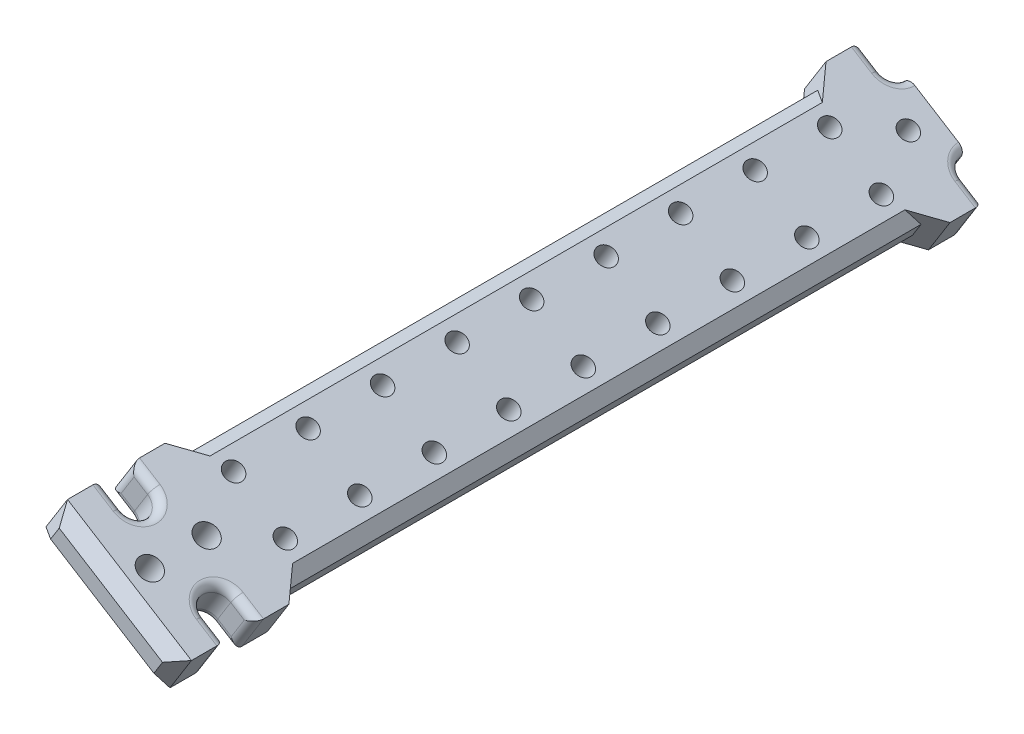
from build123d import *

# Parameters (mm, degrees)
BOSS_EXTRU_1_OUTLINE_R   = 2.75
BOSS_EXTRU_1_OUTLINE_R_2 = 2.3
BOSS_EXTRU_1_DEPTH       = 10
ESQUISSE2_R              = 2.3
ENL_V_MAT_EXTRU_1_DEPTH  = 192.889965503
CONG_1_R                 = 2
CHANFREIN1_SIZE          = 3


# Read off the part's stored shape, not the designer's step: Boss.-Extru.1
with BuildPart() as part:
    # Boss.-Extru.1 outline → Boss.-Extru.1 (new body)
    with BuildSketch(Plane(origin=(0.807648755, 1.292238009, 0), x_dir=(0.8479983040028684, -0.5299989400067315, 0), z_dir=(0.5299989400067315, 0.8479983040028684, 0))):
        with BuildLine():
            Line((-3.319738136, 183.05), (-9.244866887, 183.05))
            ThreePointArc((-9.244866887, 183.05), (-11.896517316, 184.148349571), (-12.994866887, 186.8))
            Line((-12.994866887, 186.8), (-29.644053825, 186.8))
            ThreePointArc((-29.644053825, 186.8), (-30.742403396, 184.148349571), (-33.394053825, 183.05))
            Line((-33.394053825, 183.05), (-39.319182576, 183.05))
            Line((-39.319182576, 183.05), (-39.319182576, 174.8))
            Line((-39.319182576, 174.8), (-36.319182576, 171.8))
            Line((-36.319182576, 171.8), (-36.319182576, 15))
            Line((-36.319182576, 15), (-39.319182576, 12))
            Line((-39.319182576, 12), (-39.319182576, 3.75))
            Line((-39.319182576, 3.75), (-33.394053825, 3.75))
            ThreePointArc((-33.394053825, 3.75), (-29.644053825, 0), (-33.394053825, -3.75))
            Line((-33.394053825, -3.75), (-39.319182576, -3.75))
            Line((-39.319182576, -3.75), (-39.319182576, -12))
            Line((-39.319182576, -12), (-36.319182576, -15))
            Line((-36.319182576, -15), (-6.319738136, -15))
            Line((-6.319738136, -15), (-3.319738136, -12))
            Line((-3.319738136, -12), (-3.319738136, -3.75))
            Line((-3.319738136, -3.75), (-9.244866887, -3.75))
            ThreePointArc((-9.244866887, -3.75), (-12.994866887, 0), (-9.244866887, 3.75))
            Line((-9.244866887, 3.75), (-3.319738136, 3.75))
            Line((-3.319738136, 3.75), (-3.319738136, 12))
            Line((-3.319738136, 12), (-6.319738136, 15))
            Line((-6.319738136, 15), (-6.319738136, 171.8))
            Line((-6.319738136, 171.8), (-3.319738136, 174.8))
            Line((-3.319738136, 174.8), (-3.319738136, 183.05))
        make_face()
        with Locations((-21.319460356, -7)):
            Circle(BOSS_EXTRU_1_OUTLINE_R, mode=Mode.SUBTRACT)
        with Locations((-21.319460356, 7)):
            Circle(BOSS_EXTRU_1_OUTLINE_R, mode=Mode.SUBTRACT)
        with Locations((-21.319460356, 179.8)):
            Circle(BOSS_EXTRU_1_OUTLINE_R_2, mode=Mode.SUBTRACT)
    extrude(amount=BOSS_EXTRU_1_DEPTH)

    # Esquisse2 → Enlèv. mat.-Extru.1 (cut, through all)
    with BuildSketch(Plane(origin=(6.107638155, 9.772221049, 0), x_dir=(0.8479983040028684, -0.5299989400067316, 0), z_dir=(0.5299989400067316, 0.8479983040028684, 0))):
        with Locations(Location((-28.819321466, 148.45, 0), (0, 0, 180))):
            Circle(ESQUISSE2_R)
        with Locations(Location((-13.819599246, 148.45, 0), (0, 0, 180))):
            Circle(ESQUISSE2_R)
        with Locations(Location((-28.819321466, 130.1, 0), (0, 0, 180))):
            Circle(ESQUISSE2_R)
        with Locations(Location((-13.819599246, 130.1, 0), (0, 0, 180))):
            Circle(ESQUISSE2_R)
        with Locations(Location((-28.819321466, 111.75, 0), (0, 0, 180))):
            Circle(ESQUISSE2_R)
        with Locations(Location((-13.819599246, 111.75, 0), (0, 0, 180))):
            Circle(ESQUISSE2_R)
        with Locations(Location((-28.819321466, 93.4, 0), (0, 0, 180))):
            Circle(ESQUISSE2_R)
        with Locations(Location((-13.819599246, 93.4, 0), (0, 0, 180))):
            Circle(ESQUISSE2_R)
        with Locations(Location((-28.819321466, 75.05, 0), (0, 0, 180))):
            Circle(ESQUISSE2_R)
        with Locations(Location((-13.819599246, 75.05, 0), (0, 0, 180))):
            Circle(ESQUISSE2_R)
        with Locations(Location((-13.819599246, 56.7, 0), (0, 0, 180))):
            Circle(ESQUISSE2_R)
        with Locations(Location((-13.819599246, 38.35, 0), (0, 0, 180))):
            Circle(ESQUISSE2_R)
        with Locations(Location((-13.819599246, 20, 0), (0, 0, 180))):
            Circle(ESQUISSE2_R)
        with Locations(Location((-28.819321466, 38.35, 0), (0, 0, 180))):
            Circle(ESQUISSE2_R)
        with Locations(Location((-28.819321466, 20, 0), (0, 0, 180))):
            Circle(ESQUISSE2_R)
        with Locations(Location((-28.819321466, 56.7, 0), (0, 0, 180))):
            Circle(ESQUISSE2_R)
        with Locations(Location((-28.819321466, 166.8, 0), (0, 0, 180))):
            Circle(ESQUISSE2_R)
        with Locations(Location((-13.819599246, 166.8, 0), (0, 0, 180))):
            Circle(ESQUISSE2_R)
    extrude(amount=-ENL_V_MAT_EXTRU_1_DEPTH, mode=Mode.SUBTRACT)

    # Congé1
    cong_1_edges = [part.edges().sort_by_distance(p)[0] for p in [
        (0.78025628, 13.10183472, 3.75),
        (-4.911986926, 16.659486724, 0),
        (0.78025628, 13.10183472, -3.75),
        (-3.980588352, 16.077362616, -184.148349571),
        (0.78025628, 13.10183472, -183.05),
        (-19.961867785, 26.065662262, -184.148349571),
        (-24.722712418, 29.041190157, -183.05),
        (-4.51973312, 4.62185168, -183.05),
        (-4.51973312, 4.62185168, -3.75),
        (-10.211976326, 8.179503684, 0),
        (-4.51973312, 4.62185168, 3.75),
        (-30.022701818, 20.561207117, 3.75),
        (-24.330458612, 17.003555113, 0),
        (-30.022701818, 20.561207117, -3.75),
        (-30.022701818, 20.561207117, -183.05),
        (-25.261857185, 17.585679222, -184.148349571),
        (-9.280577752, 7.597379576, -184.148349571),
        (0.642511146, 7.291687222, -183.05),
        (0.642511146, 7.291687222, -3.75),
        (0.642511146, 7.291687222, 3.75),
        (-29.884956684, 26.371354616, 3.75),
        (-29.884956684, 26.371354616, -3.75),
        (-29.884956684, 26.371354616, -183.05),
        (-24.722712418, 29.041190157, -3.75),
        (-19.030469212, 25.483538153, 0),
        (-24.722712418, 29.041190157, 3.75),
    ]]
    fillet(cong_1_edges, radius=CONG_1_R)

    # Chanfrein1
    chanfrein1_edges = [part.edges().sort_by_distance(p)[0] for p in [
        (0.748510934, 13.121675562, -93.4),
        (-4.551478466, 4.641692522, -93.4),
        (-17.271217469, 12.591529399, 15),
        (-29.990956472, 20.541366276, -93.4),
        (-24.690967072, 29.021349316, -93.4),
        (-11.971228069, 21.071512439, 15),
    ]]
    chamfer(chanfrein1_edges, length=CHANFREIN1_SIZE)


solid = part.part
